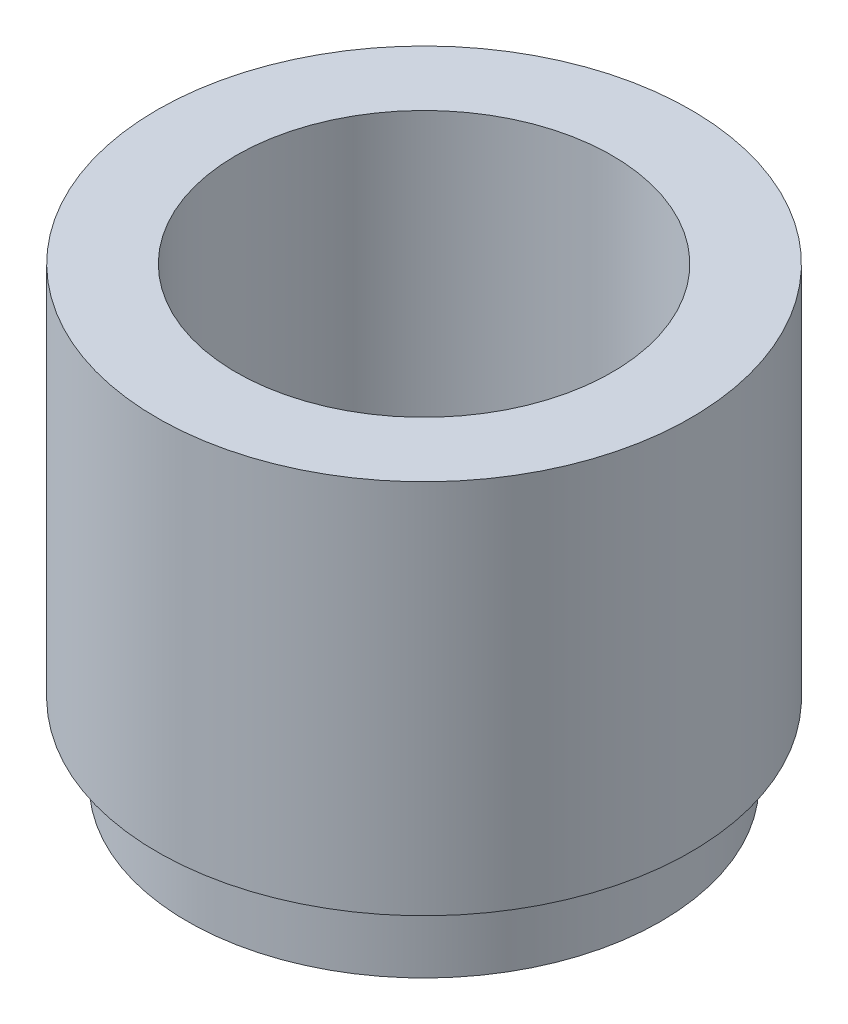
from build123d import *


with BuildPart() as part:
    # Sketch1 → Revolve1 (revolve)
    with BuildSketch(Plane.XY):
        Polygon((2.5, 0), (3.15, 0), (3.15, 1), (3.55, 1), (3.55, 6), (2.5, 6), align=None)
    revolve(axis=Axis((0, 6, 0), (0, -1, 0)))


solid = part.part
